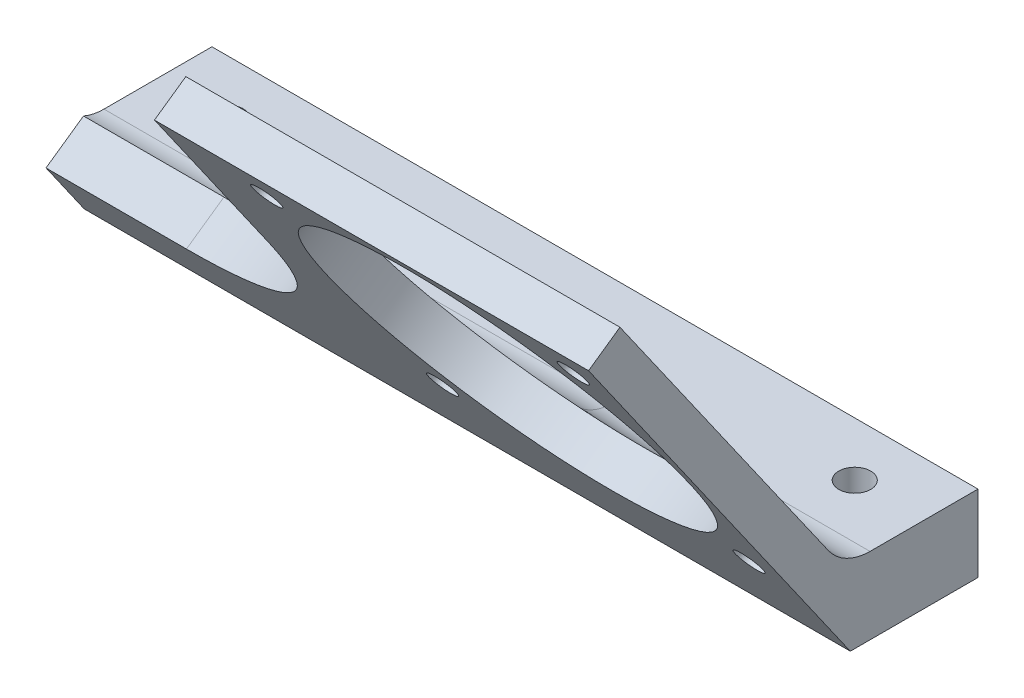
from build123d import *

# Parameters (mm, degrees)
BOSS_EXTRUDE1_DEPTH = 30
SKETCH3_R           = 1.1
SKETCH3_R_2         = 14.25
CUT_EXTRUDE1_DEPTH  = 53.348964562
FILLET2_R           = 4
CUT_EXTRUDE2_DEPTH  = 53.378356962
SKETCH5_R           = 1.25
CUT_EXTRUDE3_DEPTH  = 50.551443345
SKETCH6_R           = 4
CUT_EXTRUDE4_DEPTH  = 3.9
CUT_EXTRUDE5_START  = -5.191520443
CUT_EXTRUDE5_DEPTH  = 0.58471683


# Read off the part's stored shape, not the designer's step: Cut-Extrude5
with BuildPart() as part:
    # Sketch1 → Boss-Extrude1 (new, symmetric)
    with BuildSketch(Plane(origin=(0, 0, 0), x_dir=(0, 0, -1), z_dir=(1, 0, 0))):
        Polygon((0, 0), (-10, 0), (-30.501566051, 29.279270691), (-28.044109918, 31), (-10.538921463, 6), (0, 6), align=None)
    extrude(amount=BOSS_EXTRUDE1_DEPTH, both=True)

    # Sketch3 → Cut-Extrude1 (cut, through all)
    with BuildSketch(Plane(origin=(0, -4.698463104, 6.710100717), x_dir=(1, 0, 0), z_dir=(0, -0.5735764363510448, 0.8191520442889928))):
        with Locations(Location((3, 38.337424669, 0), (0, 0, 270))):
            Circle(SKETCH3_R)
        with Locations(Location((27, 38.337424669, 0), (0, 0, 270))):
            Circle(SKETCH3_R)
        with Locations(Location((27, 14.337424669, 0), (0, 0, 270))):
            Circle(SKETCH3_R)
        with Locations(Location((3, 14.337424669, 0), (0, 0, 270))):
            Circle(SKETCH3_R)
        with Locations(Location((15, 26.337424669, 0), (0, 0, 270))):
            Circle(SKETCH3_R_2)
    extrude(amount=-CUT_EXTRUDE1_DEPTH, mode=Mode.SUBTRACT)

    # Fillet2
    fillet2_edges = [part.edges().sort_by_distance(p)[0] for p in [
        (0, 6, 10.538921463),
    ]]
    fillet(fillet2_edges, radius=FILLET2_R)

    # Sketch4 → Cut-Extrude2 (cut, through all)
    with BuildSketch(Plane(origin=(0, -2.977733795, 4.252644584), x_dir=(-1, 0, 0), z_dir=(0, 0.5735764363510438, -0.8191520442889935))):
        with BuildLine():
            Line((4, 41.479154), (4, 25.942790865))
            ThreePointArc((4, 25.942790865), (8.399400202, 15.347179418), (18.999990368, 10.959789281))
            Line((18.999990368, 10.959789281), (30, 10.959789281))
            Line((30, 10.959789281), (30, 41.479154))
            Line((30, 41.479154), (4, 41.479154))
        make_face()
    extrude(amount=-CUT_EXTRUDE2_DEPTH, mode=Mode.SUBTRACT)

    # Sketch5 → Cut-Extrude3 (cut, through all)
    with BuildSketch(Plane(origin=(0, 6, 0), x_dir=(1, 0, 0), z_dir=(0, 1, 0))):
        with Locations(Location((-24.575, -4.22832663, 0), (0, 0, 270))):
            Circle(SKETCH5_R)
        with Locations(Location((24.575, -4.22832663, 0), (0, 0, 270))):
            Circle(SKETCH5_R)
    extrude(amount=-CUT_EXTRUDE3_DEPTH, mode=Mode.SUBTRACT)

    # Sketch6 → Cut-Extrude4 (cut)
    with BuildSketch(Plane.XZ):
        with Locations(Location((-24.575, 4.22832663, 0), (0, 0, 270))):
            Circle(SKETCH6_R)
        with Locations(Location((24.575, 4.22832663, 0), (0, 0, 270))):
            Circle(SKETCH6_R)
    extrude(amount=-CUT_EXTRUDE4_DEPTH, mode=Mode.SUBTRACT)

    # Cut-Extrude5 outline → Cut-Extrude5 (cut)
    with BuildSketch(Plane(origin=(0, 0, 0), x_dir=(1, 0, 0), z_dir=(0, 0.5735764363510437, -0.8191520442889935)).offset(CUT_EXTRUDE5_START)):
        with BuildLine():
            ThreePointArc((-10, -13.959782058), (-14.256579589, -11.729537907), (-18.999990368, -10.959789281))
            Line((-18.999990368, -10.959789281), (-31, -10.959789281))
            Line((-31, -10.959789281), (-31, -15))
            Line((-31, -15), (-10, -15))
            Line((-10, -15), (-10, -13.959782058))
        make_face()
    extrude(amount=CUT_EXTRUDE5_DEPTH, mode=Mode.SUBTRACT)


solid = part.part
